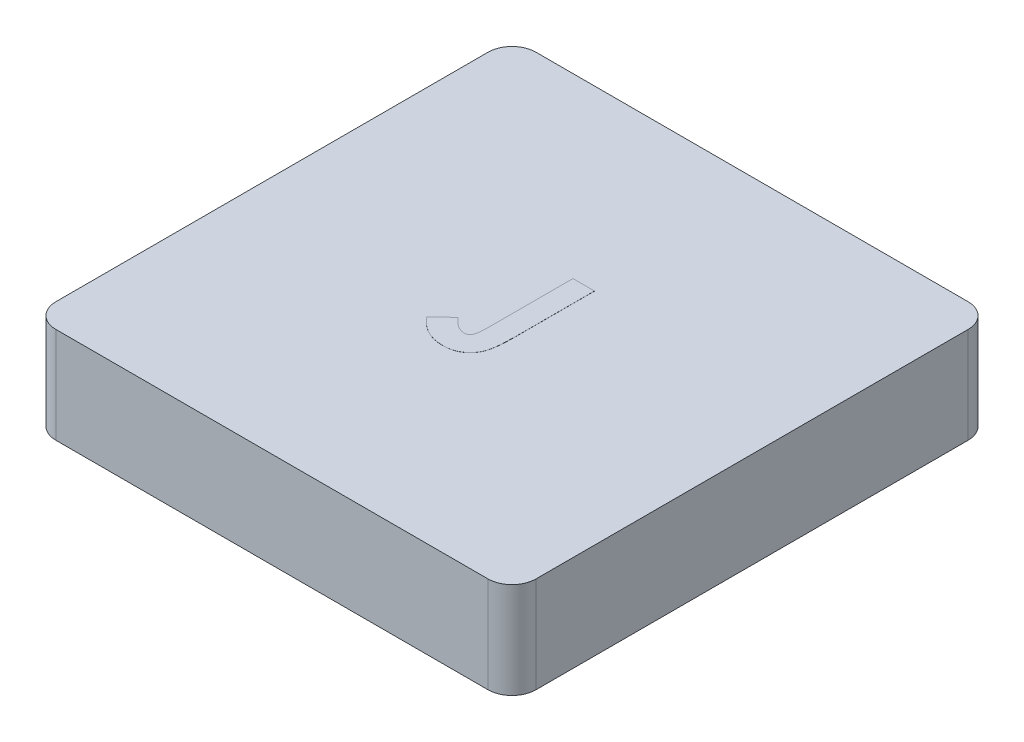
from build123d import *

# Parameters (mm, degrees)
SKETCH1_W           = 12.7
SKETCH1_H           = 12.7
BOSS_EXTRUDE1_DEPTH = 2.54
FILLET1_R           = 0.635
SHELL1_START        = 0.635
SHELL1_OUTLINE_W    = 1.905
SHELL1_OUTLINE_H    = 11.43
SHELL1_DEPTH        = 11.43
SKETCH2_R           = 2.54
BOSS_EXTRUDE2_DEPTH = 1.905
BOSS_EXTRUDE3_DEPTH = 0.00254


# Read off the part's stored shape, not the designer's step: Shell1
with BuildPart() as part:
    # Sketch1 → Boss-Extrude1 (new body)
    with BuildSketch(Plane(origin=(0, 0, 0), x_dir=(1, 0, 0), z_dir=(0, 1, 0))):
        with Locations((6.35, 6.35)):
            Rectangle(SKETCH1_W, SKETCH1_H)
    extrude(amount=BOSS_EXTRUDE1_DEPTH)

    # Fillet1
    fillet1_edges = [part.edges().sort_by_distance(p)[0] for p in [
        (0, 1.27, -12.7),
        (12.7, 1.27, -12.7),
        (12.7, 1.27, 0),
        (0, 1.27, 0),
    ]]
    fillet(fillet1_edges, radius=FILLET1_R)

    # Shell1 outline → Shell1 (cut)
    with BuildSketch(Plane.YZ.offset(SHELL1_START)):
        with Locations((0.9525, -6.35)):
            Rectangle(SHELL1_OUTLINE_W, SHELL1_OUTLINE_H)
    extrude(amount=SHELL1_DEPTH, mode=Mode.SUBTRACT)

    # Sketch2 → Boss-Extrude2 (add)
    with BuildSketch(Plane(origin=(0, 1.905, 0), x_dir=(-1, 0, 0), z_dir=(0, -1, 0))):
        with Locations(Location((-6.35, 6.35, 0), (0, 0, 270))):
            Circle(SKETCH2_R)
    extrude(amount=BOSS_EXTRUDE2_DEPTH)

    # Sketch3 → Boss-Extrude3 (add)
    with BuildSketch(Plane(origin=(0, 2.54, 0), x_dir=(1, 0, 0), z_dir=(0, 1, 0))):
        with BuildLine():
            Line((6.311248718, 8.001), (6.881120513, 8.001))
            Line((6.881120513, 8.001), (6.881120513, 5.89323758))
            add(Edge.make_bspline(
                [(6.881120513, 5.89323758), (6.880911581, 5.85295254), (6.88050901, 5.775331222), (6.876478561, 5.663585177), (6.871028683, 5.561130731), (6.863180334, 5.468132049), (6.851523386, 5.384593628), (6.83833126, 5.310307047), (6.823776683, 5.24496961), (6.799190432, 5.171846852), (6.76102099, 5.090871717), (6.703422211, 5.003407063), (6.631693296, 4.927415182), (6.549085279, 4.861407451), (6.454902126, 4.809141814), (6.351313596, 4.771364071), (6.238650837, 4.748795386), (6.160617709, 4.746019084), (6.120443429, 4.744589744)],
                knots=[0, 0, 0, 0, 1.22248561, 2.355488409, 3.392943897, 4.335991845, 5.186735882, 5.951517034, 6.625683685, 7.215700098, 8.28923535, 9.333114649, 10.380102123, 11.447198135, 12.530158036, 13.633358744, 14.781567393, 16, 16, 16, 16], degree=3))
            add(Edge.make_bspline(
                [(6.120443429, 4.744589744), (6.078585486, 4.745885617), (5.996025276, 4.748441587), (5.874942226, 4.77021188), (5.758566278, 4.80511621), (5.647499501, 4.855583683), (5.540220246, 4.918801011), (5.438675534, 4.997215953), (5.34074525, 5.088396519), (5.282691579, 5.158366196), (5.252915385, 5.194254207)],
                knots=[0, 0, 0, 0, 0.990984786, 1.954608977, 2.90473533, 3.862451285, 4.837525908, 5.848096122, 6.896271184, 8, 8, 8, 8], degree=3))
            Line((5.252915385, 5.194254207), (5.684135337, 5.59303726))
            add(Edge.make_bspline(
                [(5.684135337, 5.59303726), (5.706713527, 5.567507703), (5.74896339, 5.519735039), (5.812632688, 5.457438312), (5.870065826, 5.407390082), (5.924206265, 5.371289844), (5.975297298, 5.345843205), (6.024438185, 5.327513276), (6.073160718, 5.317137495), (6.105348309, 5.315340023), (6.121079447, 5.314461538)],
                knots=[0, 0, 0, 0, 1.529509877, 2.862124173, 3.996688592, 4.944357383, 5.774364335, 6.554177287, 7.293378699, 8, 8, 8, 8], degree=3))
            add(Edge.make_bspline(
                [(6.121079447, 5.314461538), (6.136305438, 5.315255549), (6.165580013, 5.316782171), (6.205833677, 5.333752509), (6.239770106, 5.360396654), (6.262111848, 5.391027555), (6.27634945, 5.422340582), (6.285245372, 5.452609437), (6.293687618, 5.48889359), (6.300451357, 5.531174856), (6.30556205, 5.580004736), (6.308109361, 5.634790439), (6.311207218, 5.695828017), (6.311234393, 5.738468063), (6.311248718, 5.760945913)],
                knots=[0, 0, 0, 0, 1.003927327, 1.930222208, 2.840933547, 3.835773585, 4.407906147, 5.114514582, 5.922289074, 6.876303333, 7.950072246, 9.174518422, 10.510537432, 12, 12, 12, 12], degree=3))
            Line((6.311248718, 5.760945913), (6.311248718, 8.001))
        make_face()
    extrude(amount=BOSS_EXTRUDE3_DEPTH)


solid = part.part
